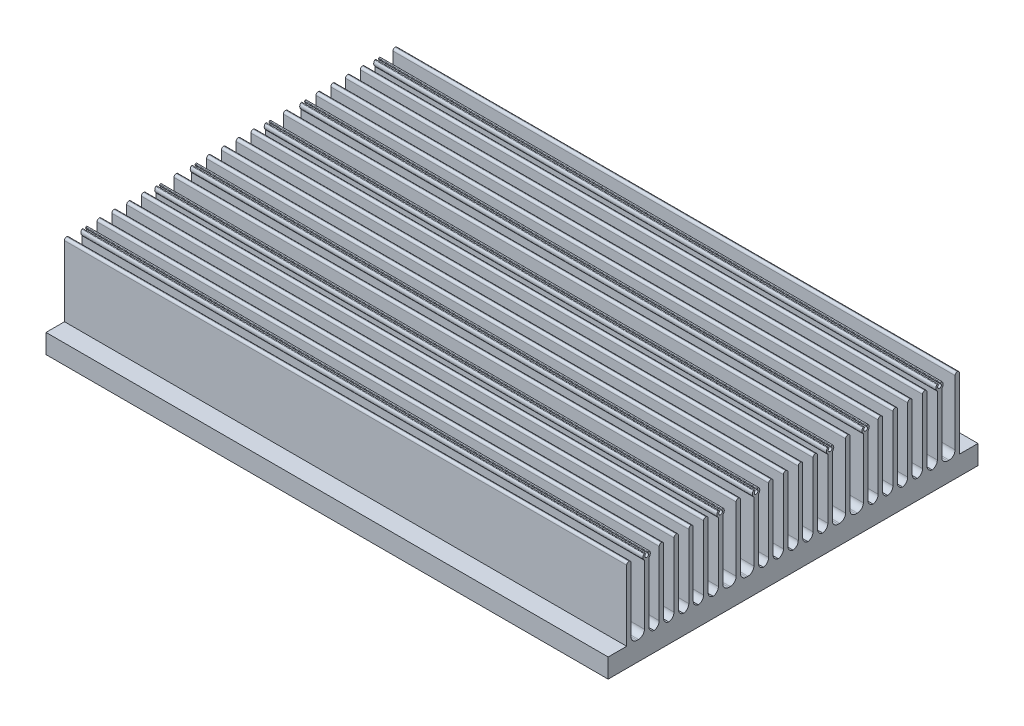
from build123d import *

# Parameters (mm, degrees)
EXTRUDE_1_DEPTH = 380
FILLET_1_R      = 1.5
FILLET_2_R      = 4


# Some blends are built 0.0001 mm under size
with BuildPart() as part:
    # Эскиз1 → Бобышка-Вытянуть1 (new body)
    with BuildSketch(Plane(origin=(0, 0, 0), x_dir=(0, 0, -1), z_dir=(1, 0, 0))):
        with BuildLine():
            Line((12.5, 13), (0, 13))
            Line((0, 13), (0, 0))
            Line((0, 0), (250, 0))
            Line((250, 0), (250, 13))
            Line((250, 13), (237.5, 13))
            Line((237.5, 13), (237.5, 62))
            Line((237.5, 62), (234.5, 62))
            Line((234.5, 62), (234.5, 13))
            Line((234.5, 13), (225.5, 13))
            Line((225.5, 13), (225.5, 57.263932023))
            ThreePointArc((225.5, 57.263932023), (225.543564535, 57.468056168), (225.666666667, 57.636610019))
            ThreePointArc((225.666666667, 57.636610019), (226.499322834, 59.441816036), (225.751573173, 61.283813729))
            ThreePointArc((225.751573173, 61.283813729), (225.333735849, 61.42247069), (224.968245837, 61.177050983))
            Line((224.968245837, 61.177050983), (224.838525492, 60.952368755))
            ThreePointArc((224.838525492, 60.952368755), (224.77495208, 60.644040102), (224.908241567, 60.358834825))
            ThreePointArc((224.908241567, 60.358834825), (224, 58.25), (223.091758433, 60.358834825))
            ThreePointArc((223.091758433, 60.358834825), (223.22504792, 60.644040102), (223.161474508, 60.952368755))
            Line((223.161474508, 60.952368755), (223.031754163, 61.177050983))
            ThreePointArc((223.031754163, 61.177050983), (222.666264151, 61.42247069), (222.248426827, 61.283813729))
            ThreePointArc((222.248426827, 61.283813729), (221.500677166, 59.441816036), (222.333333333, 57.636610019))
            ThreePointArc((222.333333333, 57.636610019), (222.456435465, 57.468056168), (222.5, 57.263932023))
            Line((222.5, 57.263932023), (222.5, 13))
            Line((222.5, 13), (215.5, 13))
            Line((215.5, 13), (215.5, 62))
            Line((215.5, 62), (212.5, 62))
            Line((212.5, 62), (212.5, 13))
            Line((212.5, 13), (205.5, 13))
            Line((205.5, 13), (205.5, 62))
            Line((205.5, 62), (202.5, 62))
            Line((202.5, 62), (202.5, 13))
            Line((202.5, 13), (195.5, 13))
            Line((195.5, 13), (195.5, 62))
            Line((195.5, 62), (192.5, 62))
            Line((192.5, 62), (192.5, 13))
            Line((192.5, 13), (185.5, 13))
            Line((185.5, 13), (185.5, 62))
            Line((185.5, 62), (182.5, 62))
            Line((182.5, 62), (182.5, 13))
            Line((182.5, 13), (175.5, 13))
            Line((175.5, 13), (175.5, 57.263932023))
            ThreePointArc((175.5, 57.263932023), (175.543564535, 57.468056168), (175.666666667, 57.636610019))
            ThreePointArc((175.666666667, 57.636610019), (176.499322834, 59.441816036), (175.751573173, 61.283813729))
            ThreePointArc((175.751573173, 61.283813729), (175.333735849, 61.42247069), (174.968245837, 61.177050983))
            Line((174.968245837, 61.177050983), (174.838525492, 60.952368755))
            ThreePointArc((174.838525492, 60.952368755), (174.77495208, 60.644040102), (174.908241567, 60.358834825))
            ThreePointArc((174.908241567, 60.358834825), (174, 58.25), (173.091758433, 60.358834825))
            ThreePointArc((173.091758433, 60.358834825), (173.22504792, 60.644040102), (173.161474508, 60.952368755))
            Line((173.161474508, 60.952368755), (173.031754163, 61.177050983))
            ThreePointArc((173.031754163, 61.177050983), (172.666264151, 61.42247069), (172.248426827, 61.283813729))
            ThreePointArc((172.248426827, 61.283813729), (171.500677166, 59.441816036), (172.333333333, 57.636610019))
            ThreePointArc((172.333333333, 57.636610019), (172.456435465, 57.468056168), (172.5, 57.263932023))
            Line((172.5, 57.263932023), (172.5, 13))
            Line((172.5, 13), (163.5, 13))
            Line((163.5, 13), (163.5, 62))
            Line((163.5, 62), (160.5, 62))
            Line((160.5, 62), (160.5, 13))
            Line((160.5, 13), (151.5, 13))
            Line((151.5, 13), (151.5, 57.263932023))
            ThreePointArc((151.5, 57.263932023), (151.543564535, 57.468056168), (151.666666667, 57.636610019))
            ThreePointArc((151.666666667, 57.636610019), (152.499322834, 59.441816036), (151.751573173, 61.283813729))
            ThreePointArc((151.751573173, 61.283813729), (151.333735849, 61.42247069), (150.968245837, 61.177050983))
            Line((150.968245837, 61.177050983), (150.838525492, 60.952368755))
            ThreePointArc((150.838525492, 60.952368755), (150.77495208, 60.644040102), (150.908241567, 60.358834825))
            ThreePointArc((150.908241567, 60.358834825), (150, 58.25), (149.091758433, 60.358834825))
            ThreePointArc((149.091758433, 60.358834825), (149.22504792, 60.644040102), (149.161474508, 60.952368755))
            Line((149.161474508, 60.952368755), (149.031754163, 61.177050983))
            ThreePointArc((149.031754163, 61.177050983), (148.666264151, 61.42247069), (148.248426827, 61.283813729))
            ThreePointArc((148.248426827, 61.283813729), (147.500677166, 59.441816036), (148.333333333, 57.636610019))
            ThreePointArc((148.333333333, 57.636610019), (148.456435465, 57.468056168), (148.5, 57.263932023))
            Line((148.5, 57.263932023), (148.5, 13))
            Line((148.5, 13), (141.5, 13))
            Line((141.5, 13), (141.5, 62))
            Line((141.5, 62), (138.5, 62))
            Line((138.5, 62), (138.5, 13))
            Line((138.5, 13), (131.5, 13))
            Line((131.5, 13), (131.5, 62))
            Line((131.5, 62), (128.5, 62))
            Line((128.5, 62), (128.5, 13))
            Line((128.5, 13), (121.5, 13))
            Line((121.5, 13), (121.5, 62))
            Line((121.5, 62), (118.5, 62))
            Line((118.5, 62), (118.5, 13))
            Line((118.5, 13), (111.5, 13))
            Line((111.5, 13), (111.5, 62))
            Line((111.5, 62), (108.5, 62))
            Line((108.5, 62), (108.5, 13))
            Line((108.5, 13), (101.5, 13))
            Line((101.5, 13), (101.5, 57.263932023))
            ThreePointArc((101.5, 57.263932023), (101.543564535, 57.468056168), (101.666666667, 57.636610019))
            ThreePointArc((101.666666667, 57.636610019), (102.499322834, 59.441816036), (101.751573173, 61.283813729))
            ThreePointArc((101.751573173, 61.283813729), (101.333735849, 61.42247069), (100.968245837, 61.177050983))
            Line((100.968245837, 61.177050983), (100.838525492, 60.952368755))
            ThreePointArc((100.838525492, 60.952368755), (100.77495208, 60.644040102), (100.908241567, 60.358834825))
            ThreePointArc((100.908241567, 60.358834825), (100, 58.25), (99.091758433, 60.358834825))
            ThreePointArc((99.091758433, 60.358834825), (99.22504792, 60.644040102), (99.161474508, 60.952368755))
            Line((99.161474508, 60.952368755), (99.031754163, 61.177050983))
            ThreePointArc((99.031754163, 61.177050983), (98.666264151, 61.42247069), (98.248426827, 61.283813729))
            ThreePointArc((98.248426827, 61.283813729), (97.500677166, 59.441816036), (98.333333333, 57.636610019))
            ThreePointArc((98.333333333, 57.636610019), (98.456435465, 57.468056168), (98.5, 57.263932023))
            Line((98.5, 57.263932023), (98.5, 13))
            Line((98.5, 13), (89.5, 13))
            Line((89.5, 13), (89.5, 62))
            Line((89.5, 62), (86.5, 62))
            Line((86.5, 62), (86.5, 13))
            Line((86.5, 13), (77.5, 13))
            Line((77.5, 13), (77.5, 57.263932023))
            ThreePointArc((77.5, 57.263932023), (77.543564535, 57.468056168), (77.666666667, 57.636610019))
            ThreePointArc((77.666666667, 57.636610019), (78.499322834, 59.441816036), (77.751573173, 61.283813729))
            ThreePointArc((77.751573173, 61.283813729), (77.333735849, 61.42247069), (76.968245837, 61.177050983))
            Line((76.968245837, 61.177050983), (76.838525492, 60.952368755))
            ThreePointArc((76.838525492, 60.952368755), (76.77495208, 60.644040102), (76.908241567, 60.358834825))
            ThreePointArc((76.908241567, 60.358834825), (76, 58.25), (75.091758433, 60.358834825))
            ThreePointArc((75.091758433, 60.358834825), (75.22504792, 60.644040102), (75.161474508, 60.952368755))
            Line((75.161474508, 60.952368755), (75.031754163, 61.177050983))
            ThreePointArc((75.031754163, 61.177050983), (74.666264151, 61.42247069), (74.248426827, 61.283813729))
            ThreePointArc((74.248426827, 61.283813729), (73.500677166, 59.441816036), (74.333333333, 57.636610019))
            ThreePointArc((74.333333333, 57.636610019), (74.456435465, 57.468056168), (74.5, 57.263932023))
            Line((74.5, 57.263932023), (74.5, 13))
            Line((74.5, 13), (67.5, 13))
            Line((67.5, 13), (67.5, 62))
            Line((67.5, 62), (64.5, 62))
            Line((64.5, 62), (64.5, 13))
            Line((64.5, 13), (57.5, 13))
            Line((57.5, 13), (57.5, 62))
            Line((57.5, 62), (54.5, 62))
            Line((54.5, 62), (54.5, 13))
            Line((54.5, 13), (47.5, 13))
            Line((47.5, 13), (47.5, 62))
            Line((47.5, 62), (44.5, 62))
            Line((44.5, 62), (44.5, 13))
            Line((44.5, 13), (37.5, 13))
            Line((37.5, 13), (37.5, 62))
            Line((37.5, 62), (34.5, 62))
            Line((34.5, 62), (34.5, 13))
            Line((34.5, 13), (27.5, 13))
            Line((27.5, 13), (27.5, 57.263932023))
            ThreePointArc((27.5, 57.263932023), (27.543564535, 57.468056168), (27.666666667, 57.636610019))
            ThreePointArc((27.666666667, 57.636610019), (28.499322834, 59.441816036), (27.751573173, 61.283813729))
            ThreePointArc((27.751573173, 61.283813729), (27.333735849, 61.42247069), (26.968245837, 61.177050983))
            Line((26.968245837, 61.177050983), (26.838525492, 60.952368755))
            ThreePointArc((26.838525492, 60.952368755), (26.77495208, 60.644040102), (26.908241567, 60.358834825))
            ThreePointArc((26.908241567, 60.358834825), (26, 58.25), (25.091758433, 60.358834825))
            ThreePointArc((25.091758433, 60.358834825), (25.22504792, 60.644040102), (25.161474508, 60.952368755))
            Line((25.161474508, 60.952368755), (25.031754163, 61.177050983))
            ThreePointArc((25.031754163, 61.177050983), (24.666264151, 61.42247069), (24.248426827, 61.283813729))
            ThreePointArc((24.248426827, 61.283813729), (23.500677166, 59.441816036), (24.333333333, 57.636610019))
            ThreePointArc((24.333333333, 57.636610019), (24.456435465, 57.468056168), (24.5, 57.263932023))
            Line((24.5, 57.263932023), (24.5, 13))
            Line((24.5, 13), (15.5, 13))
            Line((15.5, 13), (15.5, 62))
            Line((15.5, 62), (12.5, 62))
            Line((12.5, 62), (12.5, 13))
        make_face()
    extrude(amount=EXTRUDE_1_DEPTH)

    # Скругление1
    fillet_1_edges = [part.edges().sort_by_distance(p)[0] for p in [
        (190, 62, -234.5),
        (190, 62, -237.5),
        (190, 62, -12.5),
        (190, 62, -15.5),
        (190, 62, -34.5),
        (190, 62, -37.5),
        (190, 62, -44.5),
        (190, 62, -47.5),
        (190, 62, -54.5),
        (190, 62, -57.5),
        (190, 62, -64.5),
        (190, 62, -67.5),
        (190, 62, -86.5),
        (190, 62, -89.5),
        (190, 62, -108.5),
        (190, 62, -111.5),
        (190, 62, -118.5),
        (190, 62, -121.5),
        (190, 62, -128.5),
        (190, 62, -131.5),
        (190, 62, -138.5),
        (190, 62, -141.5),
        (190, 62, -160.5),
        (190, 62, -163.5),
        (190, 62, -182.5),
        (190, 62, -185.5),
        (190, 62, -192.5),
        (190, 62, -195.5),
        (190, 62, -202.5),
        (190, 62, -205.5),
        (190, 62, -212.5),
        (190, 62, -215.5),
    ]]
    fillet(fillet_1_edges, radius=FILLET_1_R - 0.0001)  # a hair under: the kernel refuses the full size

    # Скругление2
    # the kernel refuses this fillet: 4 mm, written as the material it adds along each edge
    with BuildSketch(Plane(origin=(0, 13, -225.5), x_dir=(0, 0, -1), z_dir=(1, 0, 0)), Plane(origin=(0, 13, -234.5), x_dir=(0, 1, 0), z_dir=(1, 0, 0)), Plane(origin=(0, 13, -141.5), x_dir=(0, 0, -1), z_dir=(1, 0, 0)), Plane(origin=(0, 13, -148.5), x_dir=(0, 1, 0), z_dir=(1, 0, 0)), Plane(origin=(0, 13, -151.5), x_dir=(0, 0, -1), z_dir=(1, 0, 0)), Plane(origin=(0, 13, -160.5), x_dir=(0, 1, 0), z_dir=(1, 0, 0)), Plane(origin=(0, 13, -163.5), x_dir=(0, 0, -1), z_dir=(1, 0, 0)), Plane(origin=(0, 13, -172.5), x_dir=(0, 1, 0), z_dir=(1, 0, 0)), Plane(origin=(0, 13, -175.5), x_dir=(0, 0, -1), z_dir=(1, 0, 0)), Plane(origin=(0, 13, -182.5), x_dir=(0, 1, 0), z_dir=(1, 0, 0)), Plane(origin=(0, 13, -185.5), x_dir=(0, 0, -1), z_dir=(1, 0, 0)), Plane(origin=(0, 13, -192.5), x_dir=(0, 1, 0), z_dir=(1, 0, 0)), Plane(origin=(0, 13, -195.5), x_dir=(0, 0, -1), z_dir=(1, 0, 0)), Plane(origin=(0, 13, -202.5), x_dir=(0, 1, 0), z_dir=(1, 0, 0)), Plane(origin=(0, 13, -205.5), x_dir=(0, 0, -1), z_dir=(1, 0, 0)), Plane(origin=(0, 13, -212.5), x_dir=(0, 1, 0), z_dir=(1, 0, 0)), Plane(origin=(0, 13, -215.5), x_dir=(0, 0, -1), z_dir=(1, 0, 0)), Plane(origin=(0, 13, -222.5), x_dir=(0, 1, 0), z_dir=(1, 0, 0))) as fillet_2_piece_1:
        with BuildLine():
            CenterArc((FILLET_2_R, FILLET_2_R), FILLET_2_R, 180, 90)
            Line((0, FILLET_2_R), (0, 0))
            Line((0, 0), (FILLET_2_R, 0))
        make_face()
    extrude(amount=380)
    with BuildSketch(Plane(origin=(0, 13, -15.5), x_dir=(0, 1, 0), z_dir=(1, 0, 0)), Plane(origin=(0, 13, -24.5), x_dir=(0, 0, 1), z_dir=(1, 0, 0)), Plane(origin=(0, 13, -27.5), x_dir=(0, 1, 0), z_dir=(1, 0, 0)), Plane(origin=(0, 13, -34.5), x_dir=(0, 0, 1), z_dir=(1, 0, 0)), Plane(origin=(0, 13, -37.5), x_dir=(0, 1, 0), z_dir=(1, 0, 0)), Plane(origin=(0, 13, -44.5), x_dir=(0, 0, 1), z_dir=(1, 0, 0)), Plane(origin=(0, 13, -47.5), x_dir=(0, 1, 0), z_dir=(1, 0, 0)), Plane(origin=(0, 13, -54.5), x_dir=(0, 0, 1), z_dir=(1, 0, 0)), Plane(origin=(0, 13, -57.5), x_dir=(0, 1, 0), z_dir=(1, 0, 0)), Plane(origin=(0, 13, -64.5), x_dir=(0, 0, 1), z_dir=(1, 0, 0)), Plane(origin=(0, 13, -67.5), x_dir=(0, 1, 0), z_dir=(1, 0, 0)), Plane(origin=(0, 13, -74.5), x_dir=(0, 0, 1), z_dir=(1, 0, 0)), Plane(origin=(0, 13, -77.5), x_dir=(0, 1, 0), z_dir=(1, 0, 0)), Plane(origin=(0, 13, -86.5), x_dir=(0, 0, 1), z_dir=(1, 0, 0)), Plane(origin=(0, 13, -89.5), x_dir=(0, 1, 0), z_dir=(1, 0, 0)), Plane(origin=(0, 13, -98.5), x_dir=(0, 0, 1), z_dir=(1, 0, 0)), Plane(origin=(0, 13, -101.5), x_dir=(0, 1, 0), z_dir=(1, 0, 0)), Plane(origin=(0, 13, -108.5), x_dir=(0, 0, 1), z_dir=(1, 0, 0)), Plane(origin=(0, 13, -111.5), x_dir=(0, 1, 0), z_dir=(1, 0, 0)), Plane(origin=(0, 13, -118.5), x_dir=(0, 0, 1), z_dir=(1, 0, 0)), Plane(origin=(0, 13, -121.5), x_dir=(0, 1, 0), z_dir=(1, 0, 0)), Plane(origin=(0, 13, -128.5), x_dir=(0, 0, 1), z_dir=(1, 0, 0)), Plane(origin=(0, 13, -131.5), x_dir=(0, 1, 0), z_dir=(1, 0, 0)), Plane(origin=(0, 13, -138.5), x_dir=(0, 0, 1), z_dir=(1, 0, 0))) as fillet_2_piece_2:
        with BuildLine():
            CenterArc((FILLET_2_R, -FILLET_2_R), FILLET_2_R, 90, 90)
            Line((0, -FILLET_2_R), (0, 0))
            Line((0, 0), (FILLET_2_R, 0))
        make_face()
    extrude(amount=380)


solid = part.part
